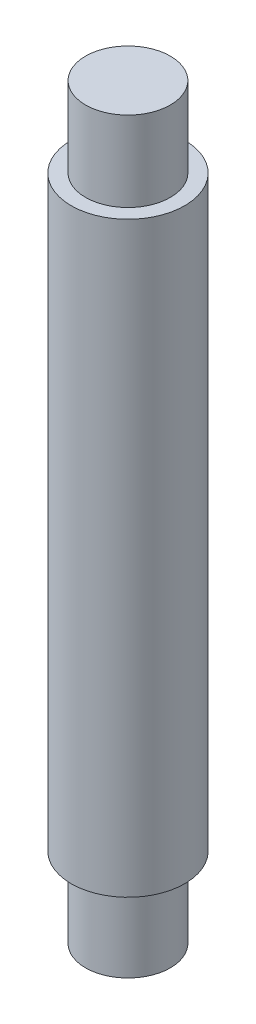
from build123d import *

# Parameters (mm, degrees)
ESBO_O1_R                     = 4.25
RESSALTO_EXTRUS_O1_DEPTH      = 44
RESSALTO_EXTRUS_O2_DEPTH      = 6
RESSALTO_EXTRUS_O2_DEPTH_BACK = 50
ESBO_O2_R                     = 3.175


with BuildPart() as part:
    # Esboço1 → Ressalto-extrusão1 (new body)
    with BuildSketch(Plane(origin=(0, 0, 0), x_dir=(1, 0, 0), z_dir=(0, 1, 0))):
        Circle(ESBO_O1_R)
    extrude(amount=RESSALTO_EXTRUS_O1_DEPTH)

    # Esboço2 → Ressalto-extrusão2 (add, two sides: drawn at the far end of the back side and taken through both)
    with BuildSketch(Plane(origin=(0, 0, 0), x_dir=(-1, 0, 0), z_dir=(0, -1, 0)).offset(-RESSALTO_EXTRUS_O2_DEPTH_BACK)):
        Circle(ESBO_O2_R)
    extrude(amount=RESSALTO_EXTRUS_O2_DEPTH + RESSALTO_EXTRUS_O2_DEPTH_BACK)


solid = part.part
